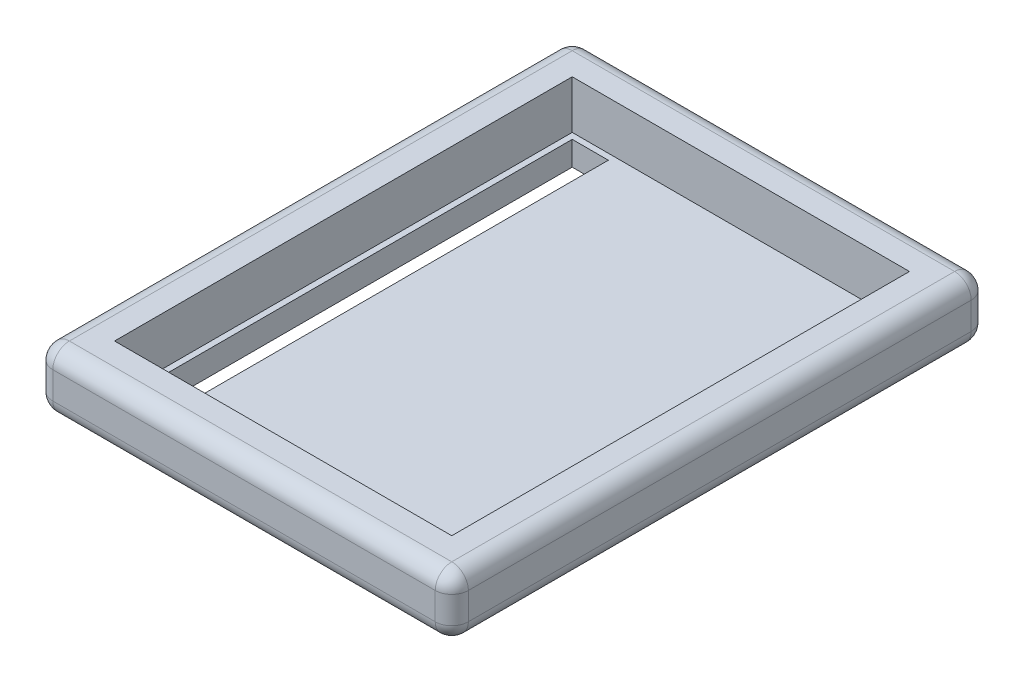
from build123d import *

# Parameters (mm, degrees)
SKETCH1_W           = 711.2
SKETCH1_H           = 965.2
SKETCH1_W_2         = 76.2
SKETCH1_H_2         = 939.8
BOSS_EXTRUDE1_DEPTH = 50.8
SKETCH2_W           = 711.2
SKETCH2_H           = 127
BOSS_EXTRUDE2_DEPTH = 82.55
SKETCH3_W           = 711.2
SKETCH3_H           = 127
BOSS_EXTRUDE3_DEPTH = 82.55
SKETCH4_W           = 1130.3
SKETCH4_H           = 127
BOSS_EXTRUDE4_DEPTH = 82.55
SKETCH5_W           = 1130.3
SKETCH5_H           = 127
BOSS_EXTRUDE5_DEPTH = 82.55
FILLET1_R           = 34.925


with BuildPart() as part:
    # Sketch1 → Boss-Extrude1 (new body)
    with BuildSketch(Plane(origin=(0, 0, 0), x_dir=(1, 0, 0), z_dir=(0, 1, 0))):
        Rectangle(SKETCH1_W, SKETCH1_H)
        with Locations((-304.8, 0)):
            Rectangle(SKETCH1_W_2, SKETCH1_H_2, mode=Mode.SUBTRACT)
        with Locations((304.8, 0)):
            Rectangle(SKETCH1_W_2, SKETCH1_H_2, mode=Mode.SUBTRACT)
    extrude(amount=BOSS_EXTRUDE1_DEPTH)

    # Sketch2 → Boss-Extrude2 (add)
    with BuildSketch(Plane.XY.offset(482.6)):
        with Locations((0, 88.9)):
            Rectangle(SKETCH2_W, SKETCH2_H)
    extrude(amount=BOSS_EXTRUDE2_DEPTH)

    # Sketch3 → Boss-Extrude3 (add)
    with BuildSketch(Plane(origin=(0, 0, -482.6), x_dir=(-1, 0, 0), z_dir=(0, 0, -1))):
        with Locations((0, 88.9)):
            Rectangle(SKETCH3_W, SKETCH3_H)
    extrude(amount=BOSS_EXTRUDE3_DEPTH)

    # Sketch4 → Boss-Extrude4 (add)
    with BuildSketch(Plane(origin=(355.6, 0, 0), x_dir=(0, 0, -1), z_dir=(1, 0, 0))):
        with Locations((0, 88.9)):
            Rectangle(SKETCH4_W, SKETCH4_H)
    extrude(amount=BOSS_EXTRUDE4_DEPTH)

    # Sketch5 → Boss-Extrude5 (add)
    with BuildSketch(Plane.ZY.offset(355.6)):
        with Locations((0, 88.9)):
            Rectangle(SKETCH5_W, SKETCH5_H)
    extrude(amount=BOSS_EXTRUDE5_DEPTH)

    # Fillet1
    fillet1_edges = [part.edges().sort_by_distance(p)[0] for p in [
        (-438.15, 88.9, 565.15),
        (-438.15, 88.9, -565.15),
        (438.15, 88.9, -565.15),
        (438.15, 88.9, 565.15),
        (0, 25.4, 565.15),
        (438.15, 25.4, 0),
        (0, 25.4, -565.15),
        (-438.15, 25.4, 0),
        (-438.15, 152.4, 0),
        (0, 152.4, 565.15),
        (438.15, 152.4, 0),
        (0, 152.4, -565.15),
    ]]
    fillet(fillet1_edges, radius=FILLET1_R)


solid = part.part
